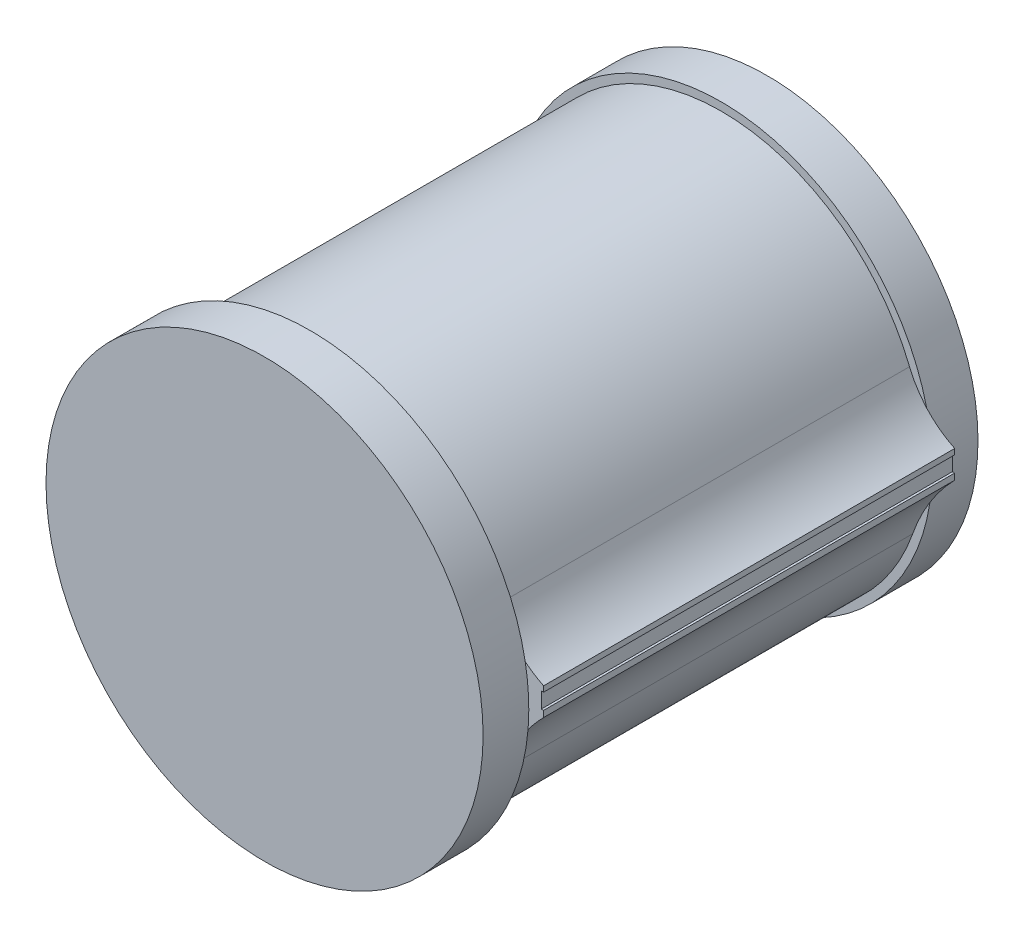
from build123d import *

# Parameters (mm, degrees)
CROQUIS1_R              = 44.422335488
SALIENTE_EXTRUIR1_DEPTH = 50
CROQUIS2_R              = 46.199565805
SALIENTE_EXTRUIR2_DEPTH = 10
CROQUIS3_R              = 47.848668402
SALIENTE_EXTRUIR3_DEPTH = 10
CROQUIS5_R              = 40.518185266
CORTAR_EXTRUIR4_DEPTH   = 105
CROQUIS8_W              = 90
CROQUIS8_H              = 6.022343016
SALIENTE_EXTRUIR4_DEPTH = 45.5
CROQUIS9_W              = 59.465557631
CROQUIS9_H              = 90
CORTAR_EXTRUIR5_DEPTH   = 45
CROQUIS10_W             = 22.822208634
CROQUIS10_H             = 90
CORTAR_EXTRUIR6_DEPTH   = 45
CROQUIS11_W             = 90
CROQUIS11_H             = 3.447121101
CORTAR_EXTRUIR7_DEPTH   = 0.5
REDONDEO1_R             = 20
REDONDEO2_R             = 40


with BuildPart() as part:
    # Croquis1 → Saliente-Extruir1 (new, symmetric)
    with BuildSketch(Plane(origin=(0, 9.520016683, 0), x_dir=(1, 0, 0), z_dir=(0, 0, 1))):
        with Locations(Location((-87.884188046, 0, 0), (0, 0, 180))):
            Circle(CROQUIS1_R)
    extrude(amount=SALIENTE_EXTRUIR1_DEPTH, both=True)

    # Croquis2 → Saliente-Extruir2 (add)
    with BuildSketch(Plane(origin=(0, 9.520016683, -50), x_dir=(-1, 0, 0), z_dir=(0, 0, -1))):
        with Locations((87.884188046, 0)):
            Circle(CROQUIS2_R)
    extrude(amount=SALIENTE_EXTRUIR2_DEPTH)

    # Croquis3 → Saliente-Extruir3 (add)
    with BuildSketch(Plane(origin=(0, 9.520016683, 50), x_dir=(1, 0, 0), z_dir=(0, 0, 1))):
        with Locations((-87.884188046, 0)):
            Circle(CROQUIS3_R)
    extrude(amount=-SALIENTE_EXTRUIR3_DEPTH)

    # Croquis5 → Cortar-Extruir4 (cut)
    with BuildSketch(Plane(origin=(0, 9.520016683, -60), x_dir=(-1, 0, 0), z_dir=(0, 0, -1))):
        with Locations((87.884188046, 0)):
            Circle(CROQUIS5_R)
    extrude(amount=-CORTAR_EXTRUIR4_DEPTH, mode=Mode.SUBTRACT)

    # Croquis8 → Saliente-Extruir4 (add, symmetric)
    with BuildSketch(Plane(origin=(0, 0, 0), x_dir=(0, 0, -1), z_dir=(1, 0, 0))):
        with Locations((5, 12.531188191)):
            Rectangle(CROQUIS8_W, CROQUIS8_H)
    extrude(amount=SALIENTE_EXTRUIR4_DEPTH, both=True)

    # Croquis9 → Cortar-Extruir5 (cut)
    with BuildSketch(Plane(origin=(0, 15.542359699, 0), x_dir=(1, 0, 0), z_dir=(0, 1, 0))):
        with Locations((15.767221184, 5)):
            Rectangle(CROQUIS9_W, CROQUIS9_H)
    extrude(amount=-CORTAR_EXTRUIR5_DEPTH, mode=Mode.SUBTRACT)

    # Croquis10 → Cortar-Extruir6 (cut)
    with BuildSketch(Plane(origin=(0, 15.542359699, 0), x_dir=(1, 0, 0), z_dir=(0, 1, 0))):
        with Locations((-25.376661948, 5)):
            Rectangle(CROQUIS10_W, CROQUIS10_H)
    extrude(amount=-CORTAR_EXTRUIR6_DEPTH, mode=Mode.SUBTRACT)

    # Croquis11 → Cortar-Extruir7 (cut)
    with BuildSketch(Plane(origin=(-36.787766265, 0, 0), x_dir=(0, 0, -1), z_dir=(1, 0, 0))):
        with Locations((5, 12.607575702)):
            Rectangle(CROQUIS11_W, CROQUIS11_H)
    extrude(amount=-CORTAR_EXTRUIR7_DEPTH, mode=Mode.SUBTRACT)

    # Redondeo1
    # the kernel refuses this fillet: 20 mm, written as the material it adds along each edge
    with BuildSketch(Plane(origin=(-43.871970711, 15.542359699, -50), x_dir=(-0.25635201555955867, 0.966583490505891, 0), z_dir=(0, 0, 1))) as redondeo1_piece_1:
        with BuildLine():
            CenterArc((13.381955248, -19.848268644), REDONDEO1_R, 97.062122585, 42.393283836)
            Line((-1.816050088, -6.847475061), (-2.120010195, -6.587459189))
            ThreePointArc((-2.120010195, -6.587459189), (-1.29465844, -3.321196724), (-0.386633396, 0.102540806))
            Line((-0.386633396, 0.102540806), (0.049178173, 0.396965373))
            ThreePointArc((0.049178173, 0.396965373), (5.46152329, 0.06298694), (10.873868406, 0.396965373))
            Line((10.873868406, 0.396965373), (10.92304658, 0))
        make_face()
    extrude(amount=90)

    # Redondeo2
    # the kernel refuses this fillet: 40 mm, written as the material it adds along each edge
    with BuildSketch(Plane(origin=(-43.461852558, 9.520016683, -50), x_dir=(1, 0, 0), z_dir=(0, 0, 1))) as redondeo2_piece_1:
        with BuildLine():
            CenterArc((35.211176648, -28.029171841), REDONDEO2_R, 135.514455154, 25.094644296)
            Line((-2.519839285, -14.748718663), (-3.274459604, -14.483109599))
            ThreePointArc((-3.274459604, -14.483109599), (-1.423064565, -7.346485792), (-0.8, 0))
            Line((-0.8, 0), (0, 0.8))
            ThreePointArc((0, 0.8), (3.337043147, 0.8), (6.103344486, 0.560583437))
            Line((6.103344486, 0.560583437), (6.674086293, 0))
        make_face()
    extrude(amount=90)


solid = part.part
